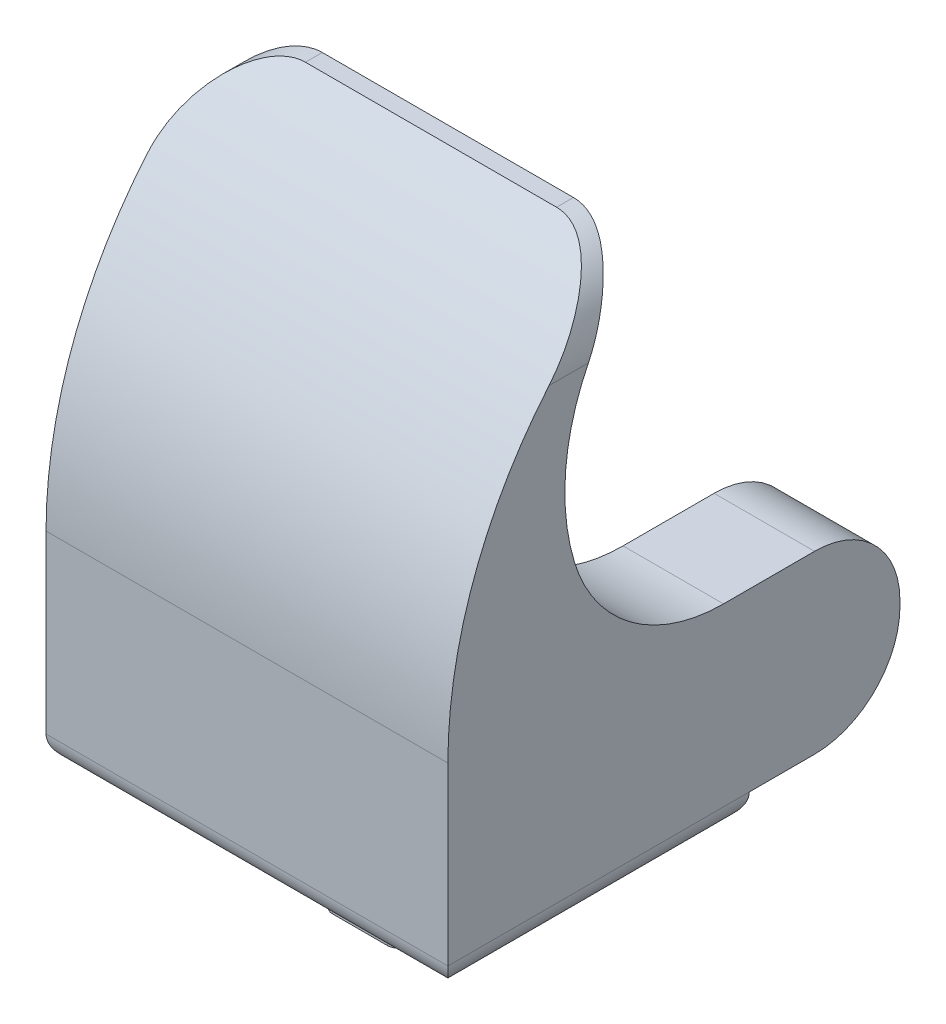
from build123d import *

# Parameters (mm, degrees)
SKETCH1_W           = 80
SKETCH1_H           = 60
BOSS_EXTRUDE1_DEPTH = 40
SKETCH2_W           = 80
SKETCH2_H           = 40
BOSS_EXTRUDE2_DEPTH = 70
CUT_EXTRUDE1_REACH  = 141.284
FILLET4_R           = 31
FILLET6_R           = 5
FILLET7_R           = 15
SKETCH5_W           = 20
SKETCH5_H           = 35
BOSS_EXTRUDE4_DEPTH = 30
FILLET8_R           = 17
FILLET9_R           = 37
SKETCH6_W           = 15
SKETCH6_H           = 15
BOSS_EXTRUDE5_DEPTH = 20
FILLET10_R          = 2


with BuildPart() as part:
    # Sketch1 → Boss-Extrude1 (new body)
    with BuildSketch(Plane(origin=(0, 0, 0), x_dir=(1, 0, 0), z_dir=(0, 1, 0))):
        Rectangle(SKETCH1_W, SKETCH1_H)
    extrude(amount=BOSS_EXTRUDE1_DEPTH)

    # Sketch2 → Boss-Extrude2 (add)
    with BuildSketch(Plane(origin=(0, 40, 0), x_dir=(1, 0, 0), z_dir=(0, 1, 0))):
        with Locations((0, -10)):
            Rectangle(SKETCH2_W, SKETCH2_H)
    extrude(amount=BOSS_EXTRUDE2_DEPTH)

    # Sketch3 → Cut-Extrude1 (cut, up to next)
    with BuildSketch(Plane(origin=(40, 0, 0), x_dir=(0, 0, -1), z_dir=(1, 0, 0)), mode=Mode.PRIVATE) as cut_extrude1_sk1:
        with BuildLine():
            ThreePointArc((10, 110), (-6.715728753, 75), (10, 40))
            Line((10, 40), (10, 110))
        make_face()
    cut_extrude1_tool1 = extrude(cut_extrude1_sk1.sketch, amount=-CUT_EXTRUDE1_REACH, mode=Mode.PRIVATE) & part.part
    # Sketch3 → Cut-Extrude1 (cut, up to next)
    with BuildSketch(Plane(origin=(40, 0, 0), x_dir=(0, 0, -1), z_dir=(1, 0, 0)), mode=Mode.PRIVATE) as cut_extrude1_sk2:
        with BuildLine():
            ThreePointArc((-30, 40), (-20.28517386, 79.505502482), (6.643401936, 110))
            Line((6.643401936, 110), (-30, 110))
            Line((-30, 110), (-30, 40))
        make_face()
    cut_extrude1_tool2 = extrude(cut_extrude1_sk2.sketch, amount=-CUT_EXTRUDE1_REACH, mode=Mode.PRIVATE) & part.part
    add(cut_extrude1_tool1.solids().sort_by_distance((40, 75, -3.194337))[0], mode=Mode.SUBTRACT)
    add(cut_extrude1_tool2.solids().sort_by_distance((40, 93.341036, 19.578223))[0], mode=Mode.SUBTRACT)

    # Fillet4
    fillet4_edges = [part.edges().sort_by_distance(p)[0] for p in [
        (0, 40, -10),
    ]]
    fillet(fillet4_edges, radius=FILLET4_R)

    # Fillet6
    fillet6_edges = [part.edges().sort_by_distance(p)[0] for p in [
        (0, 0, -30),
        (40, 0, 0),
        (0, 0, 30),
        (-40, 0, 0),
    ]]
    fillet(fillet6_edges, radius=FILLET6_R)

    # Fillet7
    # the kernel refuses this fillet: 15 mm, written as the material it takes off along each edge
    with BuildSketch(Plane(origin=(-40, 110, -47.5), x_dir=(1, 0, 0), z_dir=(0, 0, 1))) as fillet7_piece_1:
        with BuildLine():
            CenterArc((FILLET7_R, -FILLET7_R), FILLET7_R, 90, 90)
            Line((0, -FILLET7_R), (0, 0))
            Line((0, 0), (FILLET7_R, 0))
        make_face()
    extrude(amount=78.356598064, mode=Mode.SUBTRACT)
    with BuildSketch(Plane(origin=(40, 110, 30.856598064), x_dir=(0, -1, 0), z_dir=(0, 0, -1))) as fillet7_piece_2:
        with BuildLine():
            CenterArc((FILLET7_R, FILLET7_R), FILLET7_R, 180, 90)
            Line((0, FILLET7_R), (0, 0))
            Line((0, 0), (FILLET7_R, 0))
        make_face()
    extrude(amount=78.356598064, mode=Mode.SUBTRACT)

    # Sketch5 → Boss-Extrude4 (add)
    with BuildSketch(Plane(origin=(0, 0, -30), x_dir=(-1, 0, 0), z_dir=(0, 0, -1))):
        with Locations((-30, 22.5)):
            Rectangle(SKETCH5_W, SKETCH5_H)
    extrude(amount=BOSS_EXTRUDE4_DEPTH)

    # Fillet8
    fillet8_edges = [part.edges().sort_by_distance(p)[0] for p in [
        (30, 5, -60),
        (30, 40, -60),
    ]]
    fillet(fillet8_edges, radius=FILLET8_R)

    # Fillet9
    # the kernel refuses this fillet: 37 mm, written as the material it takes off along each edge
    with BuildSketch(Plane(origin=(20, 40, -30), x_dir=(0, 0.18084372085202682, 0.9835118446812903), z_dir=(-1, 0, 0))) as fillet9_piece_1:
        with BuildLine():
            CenterArc((31.132759532, -35.282188472), FILLET9_R, 107.527471669, 62.053620325)
            Line((-5.257178722, -28.5909708), (-8.896172547, -27.921849033))
            Line((-8.896172547, -27.921849033), (-3.638993825, 0.669121767))
            Line((-3.638993825, 0.669121767), (0.669121767, 3.638993825))
            ThreePointArc((0.669121767, 3.638993825), (5.716638919, 2.710879143), (18.875423616, 3.528218847))
            Line((18.875423616, 3.528218847), (19.989726881, 0))
        make_face()
    extrude(amount=132.675715485, mode=Mode.SUBTRACT)

    # Sketch6 → Boss-Extrude5 (add)
    with BuildSketch(Plane.XZ):
        Rectangle(SKETCH6_W, SKETCH6_H)
    extrude(amount=BOSS_EXTRUDE5_DEPTH)

    # Fillet10
    fillet10_edges = [part.edges().sort_by_distance(p)[0] for p in [
        (-7.5, -10, 7.5),
        (-7.5, -10, -7.5),
        (7.5, -10, -7.5),
        (7.5, -10, 7.5),
    ]]
    fillet(fillet10_edges, radius=FILLET10_R)


solid = part.part
